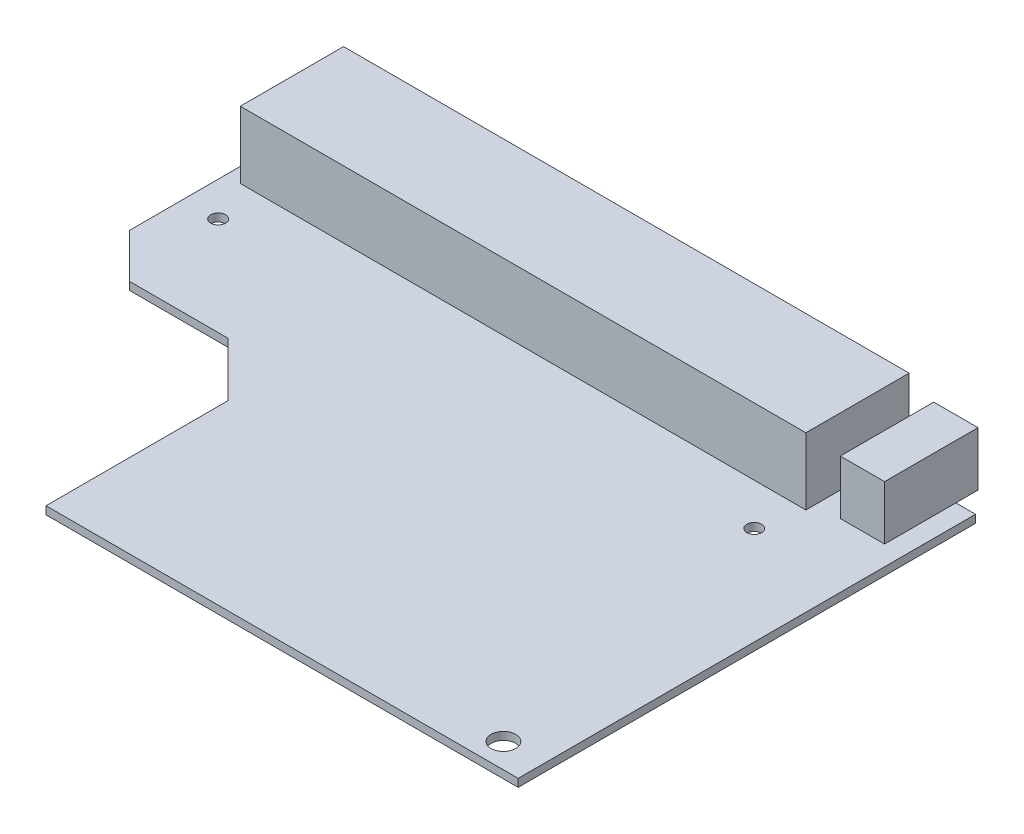
from build123d import *

# Parameters (mm, degrees)
BOSS_EXTRUDE1_DEPTH      = 1.6
SKETCH2_W                = 115
SKETCH2_H                = 21
BOSS_EXTRUDE2_DEPTH      = 13.6
CUT_EXTRUDE1_OUTLINE_R   = 2.5
CUT_EXTRUDE1_OUTLINE_R_2 = 1.5
CUT_EXTRUDE1_DEPTH       = 1.6
SKETCH5_W                = 9
SKETCH5_H                = 19
BOSS_EXTRUDE3_DEPTH      = 11


# Read off the part's stored shape, not the designer's step: Cut-Extrude1
with BuildPart() as part:
    # Sketch1 (on Top Plane) → Boss-Extrude1 (new body)
    with BuildSketch(Plane(origin=(0, 0, 0), x_dir=(1, 0, 0), z_dir=(0, 1, 0))):
        Polygon((-48, 46.5), (-88, 46.5), (-88, 10.5), (-79, 1.5), (-59, 1.5), (-48, -9.5), (-48, -46.5), (48, -46.5), (48, 46.5), align=None)
    extrude(amount=BOSS_EXTRUDE1_DEPTH)

    # Sketch2 → Boss-Extrude2 (add)
    with BuildSketch(Plane(origin=(0, 1.6, 0), x_dir=(1, 0, 0), z_dir=(0, 1, 0))):
        with Locations((-27.5, 40.5)):
            Rectangle(SKETCH2_W, SKETCH2_H)
    extrude(amount=BOSS_EXTRUDE2_DEPTH)

    # Cut-Extrude1 outline → Cut-Extrude1 (cut)
    with BuildSketch(Plane(origin=(0, 0, 0), x_dir=(1, 0, 0), z_dir=(0, 1, 0))):
        with Locations((40, -41.5)):
            Circle(CUT_EXTRUDE1_OUTLINE_R)
        with Locations((28, 21.5)):
            Circle(CUT_EXTRUDE1_OUTLINE_R_2)
        with Locations((-81, 21.5)):
            Circle(CUT_EXTRUDE1_OUTLINE_R_2)
    extrude(amount=CUT_EXTRUDE1_DEPTH, mode=Mode.SUBTRACT)

    # Sketch5 → Boss-Extrude3 (add)
    with BuildSketch(Plane(origin=(0, 1.6, 0), x_dir=(1, 0, 0), z_dir=(0, 1, 0))):
        with Locations((39.5, 41.5)):
            Rectangle(SKETCH5_W, SKETCH5_H)
    extrude(amount=BOSS_EXTRUDE3_DEPTH)


solid = part.part
